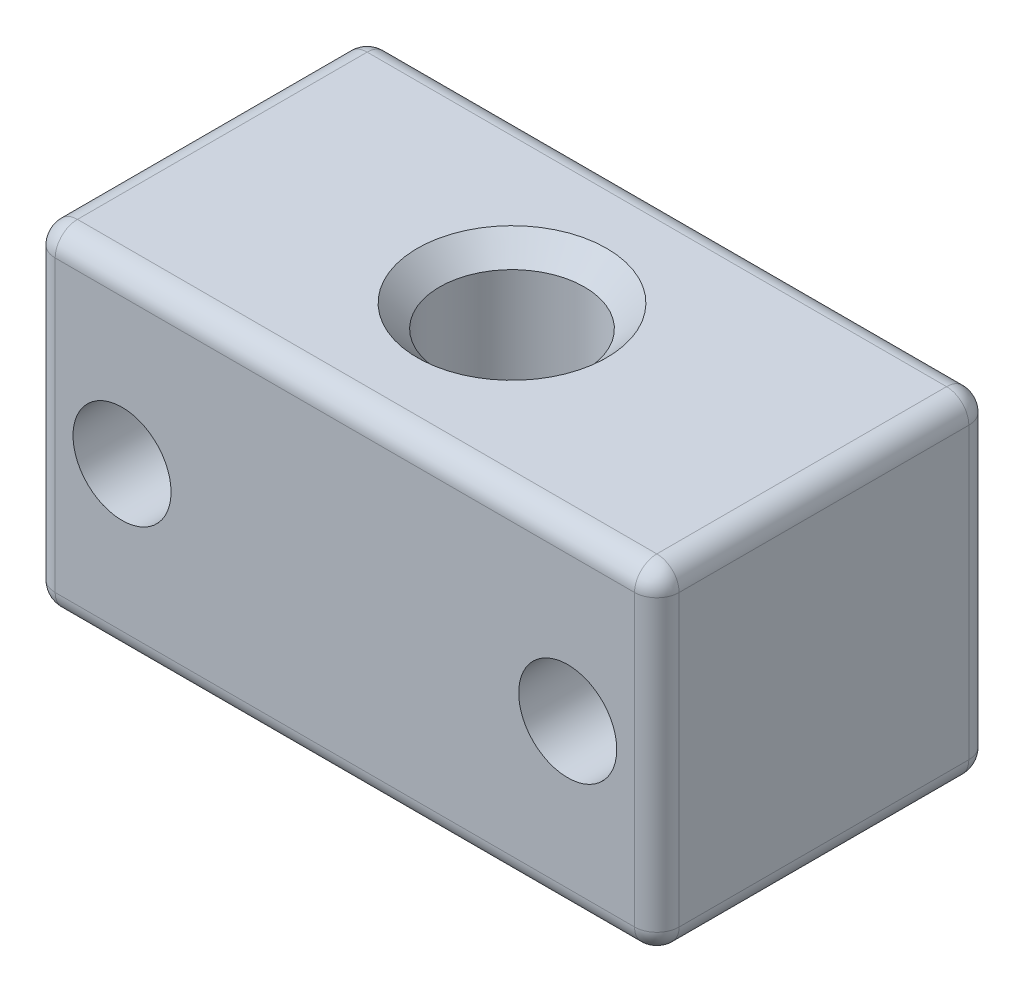
from build123d import *

# Parameters (mm, degrees)
SKETCH_1_W          = 28
SKETCH_1_H          = 15
SKETCH_1_R          = 3.25
EXTRUDE_1_DEPTH     = 7.5
SKETCH_2_R          = 2.2
CUT_EXTRUDE_1_DEPTH = 15
FILLET_1_R          = 1
CHAMFER_1_SIZE      = 1


with BuildPart() as part:
    # 草图1 → 凸台-拉伸1 (new, symmetric)
    with BuildSketch(Plane(origin=(0, 0, 0), x_dir=(1, 0, 0), z_dir=(0, 1, 0))):
        Rectangle(SKETCH_1_W, SKETCH_1_H)
        Circle(SKETCH_1_R, mode=Mode.SUBTRACT)
    extrude(amount=EXTRUDE_1_DEPTH, both=True)

    # 草图2 → 切除-拉伸1 (cut)
    with BuildSketch(Plane.XY.offset(7.5)):
        with Locations((-10, 0)):
            Circle(SKETCH_2_R)
        with Locations((10, 0)):
            Circle(SKETCH_2_R)
    extrude(amount=-CUT_EXTRUDE_1_DEPTH, mode=Mode.SUBTRACT)

    # 圆角1
    fillet_1_edges = [part.edges().sort_by_distance(p)[0] for p in [
        (14, 0, 7.5),
        (14, 7.5, 0),
        (14, 0, -7.5),
        (14, -7.5, 0),
        (-14, 0, -7.5),
        (-14, 7.5, 0),
        (-14, 0, 7.5),
        (-14, -7.5, 0),
        (0, -7.5, -7.5),
        (0, -7.5, 7.5),
        (0, 7.5, -7.5),
        (0, 7.5, 7.5),
    ]]
    fillet(fillet_1_edges, radius=FILLET_1_R)

    # 倒角1
    chamfer_1_edges = [part.edges().sort_by_distance(p)[0] for p in [
        (-3.25, -7.5, 0),
        (-3.25, 7.5, 0),
    ]]
    chamfer(chamfer_1_edges, length=CHAMFER_1_SIZE)


solid = part.part
